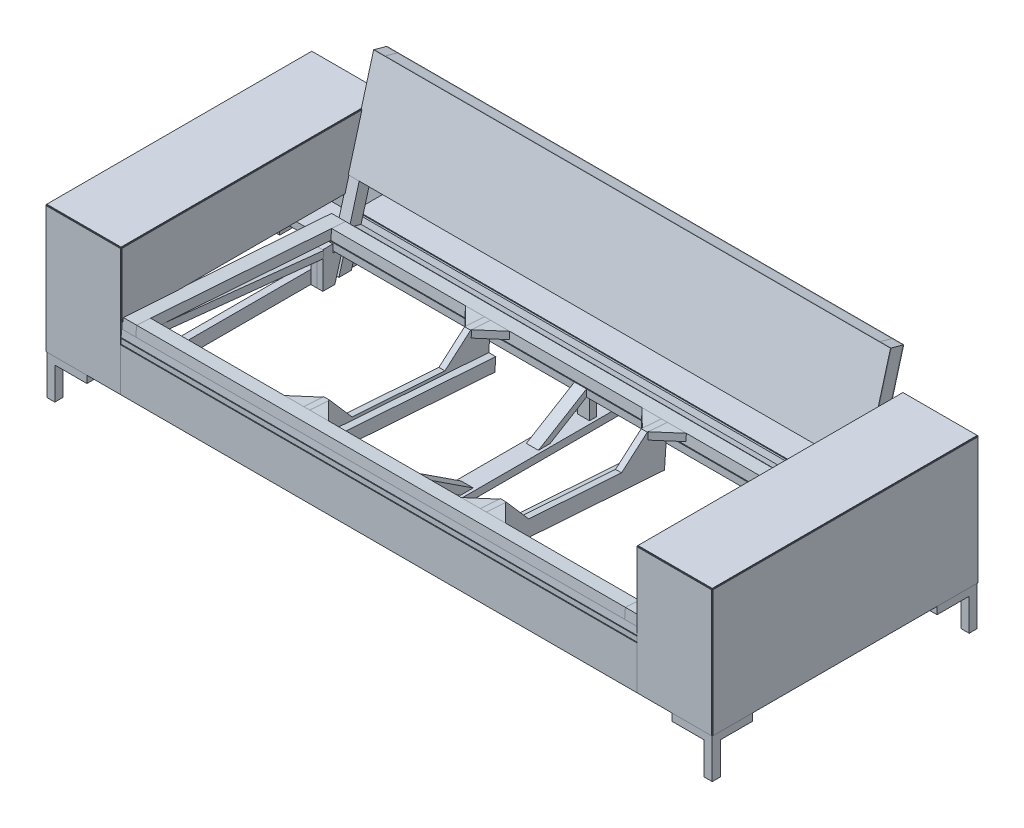
from build123d import *

# Parameters (mm, degrees)
SKETCH1_W              = 22.225
SKETCH1_H              = 41.275
BOSS_EXTRUDE1_DEPTH    = 838.2
SKETCH1_W_2            = 41.275
SKETCH1_H_2            = 22.225
BOSS_EXTRUDE1_2_DEPTH  = 838.2
BOSS_EXTRUDE1_3_DEPTH  = 838.2
BOSS_EXTRUDE1_4_DEPTH  = 838.2
BOSS_EXTRUDE1_5_DEPTH  = 838.2
BOSS_EXTRUDE1_6_DEPTH  = 838.2
BOSS_EXTRUDE1_7_DEPTH  = 838.2
SKETCH1_3_W            = 234.95
SKETCH1_3_H            = 2.54
EXTRUDE_THIN1_DEPTH    = 838.2
SKETCH1_4_W            = 2.54
SKETCH1_4_H            = 400.05
EXTRUDE_THIN2_DEPTH    = 838.2
SKETCH1_5_W            = 2.54
SKETCH1_5_H            = 203.2
EXTRUDE_THIN3_DEPTH    = 838.2
BOSS_EXTRUDE2_DEPTH    = 22.225
SKETCH3_W              = 74.6125
SKETCH3_H              = 41.275
BOSS_EXTRUDE3_DEPTH    = 22.225
BOSS_EXTRUDE3_2_DEPTH  = 22.225
BOSS_EXTRUDE3_3_DEPTH  = 22.225
BOSS_EXTRUDE3_4_DEPTH  = 22.225
SKETCH4_W              = 190.5
SKETCH4_H              = 111.125
BOSS_EXTRUDE4_DEPTH    = 22.225
BOSS_EXTRUDE4_2_DEPTH  = 22.225
EXTRUDE_THIN4_START    = -400.05
SKETCH4_3_W            = 234.95
SKETCH4_3_H            = 2.54
EXTRUDE_THIN4_DEPTH    = 400.05
SKETCH4_4_W            = 234.95
SKETCH4_4_H            = 2.54
EXTRUDE_THIN5_DEPTH    = 400.05
BOSS_EXTRUDE6_DEPTH    = 19.05
BOSS_EXTRUDE7_START    = 19.05
BOSS_EXTRUDE7_DEPTH    = 19.05
BOSS_EXTRUDE20_DEPTH   = 34.925
BOSS_EXTRUDE9_START    = 19.05
SKETCH5_4_W            = 41.275
SKETCH5_4_H            = 22.225
BOSS_EXTRUDE9_DEPTH    = 1597.025
SKETCH5_4_W_2          = 22.225
SKETCH5_4_H_2          = 41.275
BOSS_EXTRUDE9_2_DEPTH  = 1597.025
BOSS_EXTRUDE9_3_DEPTH  = 1597.025
BOSS_EXTRUDE9_4_DEPTH  = 1597.025
BOSS_EXTRUDE10_START   = 34.925
BOSS_EXTRUDE10_DEPTH   = 1562.1
BOSS_EXTRUDE11_DEPTH   = 1635.125
BOSS_EXTRUDE11_2_DEPTH = 1635.125
BOSS_EXTRUDE11_3_DEPTH = 1635.125
SKETCH5_8_W            = 22.225
SKETCH5_8_H            = 28.575
BOSS_EXTRUDE13_DEPTH   = 41.275
SKETCH5_9_W            = 2.54
SKETCH5_9_H            = 136.525
EXTRUDE_THIN6_DEPTH    = 1635.125
BOSS_EXTRUDE14_DEPTH   = 41.275
BOSS_EXTRUDE15_DEPTH   = 44.45
SKETCH7_W              = 1546.225
SKETCH7_H              = 44.45
BOSS_EXTRUDE16_DEPTH   = 31.828939175
BOSS_EXTRUDE16_2_DEPTH = 31.828939175
EXTRUDE_THIN9_DEPTH    = 1635.125
BOSS_EXTRUDE21_START   = -34.925
BOSS_EXTRUDE21_DEPTH   = 1565.275
BOSS_EXTRUDE21_2_DEPTH = 1565.275
EXTRUDE_THIN11_DEPTH   = 1635.125
EXTRUDE_THIN11_2_DEPTH = 1635.125
BOSS_EXTRUDE25_DEPTH   = 19.05
BOSS_EXTRUDE26_DEPTH   = 22.225
BOSS_EXTRUDE27_DEPTH   = 22.225
BOSS_EXTRUDE27_2_DEPTH = 22.225
BOSS_EXTRUDE27_3_DEPTH = 22.225
BOSS_EXTRUDE27_4_DEPTH = 22.225
SKETCH16_W             = 774.7
SKETCH16_H             = 22.225
BOSS_EXTRUDE28_DEPTH   = 28.575
BOSS_EXTRUDE29_DEPTH   = 19.05
BOSS_EXTRUDE29_2_DEPTH = 19.05
SKETCH16_3_W           = 22.225
SKETCH16_3_H           = 69.728910875
BOSS_EXTRUDE29_3_DEPTH = 19.05
SKETCH13_W             = 22.225
SKETCH13_H             = 101.6
SKETCH13_H_2           = 25.4
SKETCH13_W_2           = 3.175
BOSS_EXTRUDE22_DEPTH   = 25.4
BOSS_EXTRUDE23_START   = 0.508
SKETCH13_3_R           = 2.4892
BOSS_EXTRUDE23_DEPTH   = 2.032
SKETCH13_4_W           = 22.225
SKETCH13_4_H           = 25.4
SKETCH13_4_W_2         = 3.175
BOSS_EXTRUDE24_DEPTH   = 127
CHAMFER1_SIZE          = 1.27


with BuildPart() as part:
    # Sketch1 → Boss-Extrude1 (new body)
    with BuildSketch(Plane.XY):
        with Locations((-1041.4, 379.4125)):
            Rectangle(SKETCH1_W, SKETCH1_H)
    extrude(amount=BOSS_EXTRUDE1_DEPTH)


with BuildPart() as body_2:
    # Sketch1 → Boss-Extrude1 2 (new body)
    with BuildSketch(Plane.XY):
        with Locations((-935.0375, 388.9375)):
            Rectangle(SKETCH1_W_2, SKETCH1_H_2)
    extrude(amount=BOSS_EXTRUDE1_2_DEPTH)


with BuildPart() as body_3:
    # Sketch1 → Boss-Extrude1 3 (new body)
    with BuildSketch(Plane.XY):
        with Locations((-828.675, 379.4125)):
            Rectangle(SKETCH1_W, SKETCH1_H)
    extrude(amount=BOSS_EXTRUDE1_3_DEPTH)


with BuildPart() as body_4:
    # Sketch1 → Boss-Extrude1 4 (new body)
    with BuildSketch(Plane.XY):
        with Locations((-828.675, 207.9625)):
            Rectangle(SKETCH1_W, SKETCH1_H_2)
    extrude(amount=BOSS_EXTRUDE1_4_DEPTH)


with BuildPart() as body_5:
    # Sketch1 → Boss-Extrude1 5 (new body)
    with BuildSketch(Plane.XY):
        with Locations((-828.675, 20.6375)):
            Rectangle(SKETCH1_W, SKETCH1_H)
    extrude(amount=BOSS_EXTRUDE1_5_DEPTH)


with BuildPart() as body_6:
    # Sketch1 → Boss-Extrude1 6 (new body)
    with BuildSketch(Plane.XY):
        with Locations((-1041.4, 20.6375)):
            Rectangle(SKETCH1_W, SKETCH1_H)
    extrude(amount=BOSS_EXTRUDE1_6_DEPTH)


with BuildPart() as body_7:
    # Sketch1 → Boss-Extrude1 7 (new body)
    with BuildSketch(Plane.XY):
        with Locations((-1041.4, 207.9625)):
            Rectangle(SKETCH1_W, SKETCH1_H_2)
    extrude(amount=BOSS_EXTRUDE1_7_DEPTH)


with BuildPart() as body_8:
    # Sketch1<3> → Extrude-Thin1 (new body)
    with BuildSketch(Plane.XY):
        with Locations((-935.0375, 401.32)):
            Rectangle(SKETCH1_3_W, SKETCH1_3_H)
    extrude(amount=EXTRUDE_THIN1_DEPTH)


with BuildPart() as body_9:
    # Sketch1<4> → Extrude-Thin2 (new body)
    with BuildSketch(Plane.XY):
        with Locations((-1053.7825, 200.025)):
            Rectangle(SKETCH1_4_W, SKETCH1_4_H)
    extrude(amount=EXTRUDE_THIN2_DEPTH)


with BuildPart() as body_10:
    # Sketch1<5> → Extrude-Thin3 (new body)
    with BuildSketch(Plane.XY):
        with Locations((-816.2925, 298.45)):
            Rectangle(SKETCH1_5_W, SKETCH1_5_H)
    extrude(amount=EXTRUDE_THIN3_DEPTH)


with BuildPart() as body_11:
    # Sketch2 → Boss-Extrude2 (new body)
    with BuildSketch(Plane.ZY.offset(817.5625)):
        Polygon((0, 219.075), (139.7, 219.075), (95.25, 358.775), (0, 358.775), align=None)
    extrude(amount=BOSS_EXTRUDE2_DEPTH)


with BuildPart() as body_12:
    # Sketch3 → Boss-Extrude3 (new body)
    with BuildSketch(Plane.XZ.offset(-400.05)):
        with Locations((-877.09375, 261.9375)):
            Rectangle(SKETCH3_W, SKETCH3_H)
    extrude(amount=BOSS_EXTRUDE3_DEPTH)


with BuildPart() as body_13:
    # Sketch3 → Boss-Extrude3 2 (new body)
    with BuildSketch(Plane.XZ.offset(-400.05)):
        with Locations((-992.98125, 261.9375)):
            Rectangle(SKETCH3_W, SKETCH3_H)
    extrude(amount=BOSS_EXTRUDE3_2_DEPTH)


with BuildPart() as body_14:
    # Sketch3 → Boss-Extrude3 3 (new body)
    with BuildSketch(Plane.XZ.offset(-400.05)):
        with Locations((-877.09375, 604.8375)):
            Rectangle(SKETCH3_W, SKETCH3_H)
    extrude(amount=BOSS_EXTRUDE3_3_DEPTH)


with BuildPart() as body_15:
    # Sketch3 → Boss-Extrude3 4 (new body)
    with BuildSketch(Plane.XZ.offset(-400.05)):
        with Locations((-992.98125, 604.8375)):
            Rectangle(SKETCH3_W, SKETCH3_H)
    extrude(amount=BOSS_EXTRUDE3_4_DEPTH)


with BuildPart() as body_16:
    # Sketch4 → Boss-Extrude4 (new body)
    with BuildSketch(Plane.XZ):
        with Locations((-935.0375, 55.5625)):
            Rectangle(SKETCH4_W, SKETCH4_H)
    extrude(amount=-BOSS_EXTRUDE4_DEPTH)


with BuildPart() as body_17:
    # Sketch4 → Boss-Extrude4 2 (new body)
    with BuildSketch(Plane.XZ):
        with Locations((-935.0375, 782.6375)):
            Rectangle(SKETCH4_W, SKETCH4_H)
    extrude(amount=-BOSS_EXTRUDE4_2_DEPTH)


with BuildPart() as body_18:
    # Sketch4<3> → Extrude-Thin4 (new body)
    with BuildSketch(Plane.XZ.offset(EXTRUDE_THIN4_START)):
        with Locations((-935.0375, 839.47)):
            Rectangle(SKETCH4_3_W, SKETCH4_3_H)
    extrude(amount=EXTRUDE_THIN4_DEPTH)


with BuildPart() as body_19:
    # Sketch4<4> → Extrude-Thin5 (new body)
    with BuildSketch(Plane.XZ):
        with Locations((-935.0375, -1.27)):
            Rectangle(SKETCH4_4_W, SKETCH4_4_H)
    extrude(amount=-EXTRUDE_THIN5_DEPTH)


with BuildPart() as body_20:
    # Mirror Arm Geo: mirrored copy
    add(body_15.part.mirror(Plane(origin=(0, 0, 0), x_dir=(0, 0, 1), z_dir=(1, 0, 0))))


with BuildPart() as body_21:
    # Mirror Arm Geo 2: mirrored copy
    add(body_17.part.mirror(Plane(origin=(0, 0, 0), x_dir=(0, 0, 1), z_dir=(1, 0, 0))))


with BuildPart() as body_22:
    # Mirror Arm Geo 3: mirrored copy
    add(body_3.part.mirror(Plane(origin=(0, 0, 0), x_dir=(0, 0, 1), z_dir=(1, 0, 0))))


with BuildPart() as body_23:
    # Mirror Arm Geo 4: mirrored copy
    add(body_7.part.mirror(Plane(origin=(0, 0, 0), x_dir=(0, 0, 1), z_dir=(1, 0, 0))))


with BuildPart() as body_24:
    # Mirror Arm Geo 5: mirrored copy
    add(body_14.part.mirror(Plane(origin=(0, 0, 0), x_dir=(0, 0, 1), z_dir=(1, 0, 0))))


with BuildPart() as body_25:
    # Mirror Arm Geo 6: mirrored copy
    add(body_4.part.mirror(Plane(origin=(0, 0, 0), x_dir=(0, 0, 1), z_dir=(1, 0, 0))))


with BuildPart() as body_26:
    # Mirror Arm Geo 7: mirrored copy
    add(body_19.part.mirror(Plane(origin=(0, 0, 0), x_dir=(0, 0, 1), z_dir=(1, 0, 0))))


with BuildPart() as body_27:
    # Mirror Arm Geo 8: mirrored copy
    add(body_8.part.mirror(Plane(origin=(0, 0, 0), x_dir=(0, 0, 1), z_dir=(1, 0, 0))))


with BuildPart() as body_28:
    # Mirror Arm Geo 9: mirrored copy
    add(body_18.part.mirror(Plane(origin=(0, 0, 0), x_dir=(0, 0, 1), z_dir=(1, 0, 0))))


with BuildPart() as body_29:
    # Mirror Arm Geo 10: mirrored copy
    add(body_9.part.mirror(Plane(origin=(0, 0, 0), x_dir=(0, 0, 1), z_dir=(1, 0, 0))))


with BuildPart() as body_30:
    # Mirror Arm Geo 11: mirrored copy
    add(body_13.part.mirror(Plane(origin=(0, 0, 0), x_dir=(0, 0, 1), z_dir=(1, 0, 0))))


with BuildPart() as body_31:
    # Mirror Arm Geo 12: mirrored copy
    add(body_11.part.mirror(Plane(origin=(0, 0, 0), x_dir=(0, 0, 1), z_dir=(1, 0, 0))))


with BuildPart() as body_32:
    # Mirror Arm Geo 13: mirrored copy
    add(body_5.part.mirror(Plane(origin=(0, 0, 0), x_dir=(0, 0, 1), z_dir=(1, 0, 0))))


with BuildPart() as body_33:
    # Mirror Arm Geo 14: mirrored copy
    add(part.part.mirror(Plane(origin=(0, 0, 0), x_dir=(0, 0, 1), z_dir=(1, 0, 0))))


with BuildPart() as body_34:
    # Mirror Arm Geo 15: mirrored copy
    add(body_16.part.mirror(Plane(origin=(0, 0, 0), x_dir=(0, 0, 1), z_dir=(1, 0, 0))))


with BuildPart() as body_35:
    # Mirror Arm Geo 16: mirrored copy
    add(body_2.part.mirror(Plane(origin=(0, 0, 0), x_dir=(0, 0, 1), z_dir=(1, 0, 0))))


with BuildPart() as body_36:
    # Mirror Arm Geo 17: mirrored copy
    add(body_6.part.mirror(Plane(origin=(0, 0, 0), x_dir=(0, 0, 1), z_dir=(1, 0, 0))))


with BuildPart() as body_37:
    # Mirror Arm Geo 18: mirrored copy
    add(body_10.part.mirror(Plane(origin=(0, 0, 0), x_dir=(0, 0, 1), z_dir=(1, 0, 0))))


with BuildPart() as body_38:
    # Mirror Arm Geo 19: mirrored copy
    add(body_12.part.mirror(Plane(origin=(0, 0, 0), x_dir=(0, 0, 1), z_dir=(1, 0, 0))))


with BuildPart() as body_39:
    # Sketch5 → Boss-Extrude6 (new body)
    with BuildSketch(Plane(origin=(-817.5625, 0, 0), x_dir=(0, 0, -1), z_dir=(1, 0, 0))):
        Polygon((-111.125, 130.175), (-113.922886362, 120.038076396), (-150.649617496, 130.175), (-238.125, 130.175), (-238.125, 0), (0, 0), (0, 130.175), align=None)
    extrude(amount=BOSS_EXTRUDE6_DEPTH)


with BuildPart() as body_40:
    # Sketch5<3> → Boss-Extrude7 (new body)
    with BuildSketch(Plane(origin=(-817.5625, 0, 0), x_dir=(0, 0, -1), z_dir=(1, 0, 0)).offset(BOSS_EXTRUDE7_START)):
        Polygon((-200.025, 0), (-188.232142857, 41.275), (-238.125, 41.275), (-238.125, 0), align=None)
        Polygon((-206.375, 114.178910875), (-238.125, 114.178910875), (-238.125, 41.275), (-188.232142857, 41.275), (-174.625, 88.9), (-206.375, 88.9), align=None)
    extrude(amount=BOSS_EXTRUDE7_DEPTH)


with BuildPart() as body_41:
    # Sketch5<12> → Boss-Extrude20 (new body)
    with BuildSketch(Plane(origin=(-817.5625, 0, 0), x_dir=(0, 0, -1), z_dir=(1, 0, 0))):
        Polygon((-150.649617496, 130.175), (-111.125, 130.175), (0, 532.788076396), (-36.726731135, 542.925), align=None)
        Polygon((-124.904553599, 80.250784333), (-113.922886362, 120.038076396), (-135.346812857, 125.951281832), (-146.328480095, 86.163989769), align=None)
        Polygon((-135.346812857, 125.951281832), (-150.649617496, 130.175), (-161.198997976, 91.953910875), (-175.186854559, 41.275), (-135.662237063, 41.275), (-124.904553599, 80.250784333), (-146.328480095, 86.163989769), align=None)
        Polygon((-135.662237063, 41.275), (-175.186854559, 41.275), (-183.95015351, 9.525), (-144.425536013, 9.525), align=None)
        Polygon((-113.922886362, 120.038076396), (-111.125, 130.175), (-150.649617496, 130.175), (-135.346812857, 125.951281832), align=None)
    extrude(amount=BOSS_EXTRUDE20_DEPTH)


with BuildPart() as body_42:
    # Sketch5<4> → Boss-Extrude9 (new body)
    with BuildSketch(Plane(origin=(-817.5625, 0, 0), x_dir=(0, 0, -1), z_dir=(1, 0, 0)).offset(BOSS_EXTRUDE9_START)):
        with Locations((-20.6375, 11.1125)):
            Rectangle(SKETCH5_4_W, SKETCH5_4_H)
    extrude(amount=BOSS_EXTRUDE9_DEPTH)


with BuildPart() as body_43:
    # Sketch5<4> → Boss-Extrude9 2 (new body)
    with BuildSketch(Plane(origin=(-817.5625, 0, 0), x_dir=(0, 0, -1), z_dir=(1, 0, 0)).offset(BOSS_EXTRUDE9_START)):
        with Locations((-11.1125, 109.5375)):
            Rectangle(SKETCH5_4_W_2, SKETCH5_4_H_2)
    extrude(amount=BOSS_EXTRUDE9_2_DEPTH)


with BuildPart() as body_44:
    # Sketch5<4> → Boss-Extrude9 3 (new body)
    with BuildSketch(Plane(origin=(-817.5625, 0, 0), x_dir=(0, 0, -1), z_dir=(1, 0, 0)).offset(BOSS_EXTRUDE9_START)):
        Polygon((-79.375, 124.261794564), (-100.798926495, 130.175), (-111.780593733, 90.387707937), (-90.356667238, 84.474502502), align=None)
    extrude(amount=BOSS_EXTRUDE9_3_DEPTH)


with BuildPart() as body_45:
    # Sketch5<4> → Boss-Extrude9 4 (new body)
    with BuildSketch(Plane(origin=(-817.5625, 0, 0), x_dir=(0, 0, -1), z_dir=(1, 0, 0)).offset(BOSS_EXTRUDE9_START)):
        with Locations((-181.836497976, 103.066410875)):
            Rectangle(SKETCH5_4_W, SKETCH5_4_H)
    extrude(amount=BOSS_EXTRUDE9_4_DEPTH)


with BuildPart() as body_46:
    # Sketch5<5> → Boss-Extrude10 (new body)
    with BuildSketch(Plane(origin=(-817.5625, 0, 0), x_dir=(0, 0, -1), z_dir=(1, 0, 0)).offset(BOSS_EXTRUDE10_START)):
        Polygon((-124.904553599, 80.250784333), (-113.922886362, 120.038076396), (-135.346812857, 125.951281832), (-146.328480095, 86.163989769), align=None)
    extrude(amount=BOSS_EXTRUDE10_DEPTH)


with BuildPart() as body_47:
    # Sketch5<7> → Boss-Extrude11 (new body)
    with BuildSketch(Plane(origin=(-817.5625, 0, 0), x_dir=(0, 0, -1), z_dir=(1, 0, 0))):
        Polygon((-838.2, 0), (-815.975, 0), (-815.975, 12.7), (-815.975, 41.275), (-838.2, 41.275), align=None)
    extrude(amount=BOSS_EXTRUDE11_DEPTH)


with BuildPart() as body_48:
    # Sketch5<7> → Boss-Extrude11 2 (new body)
    with BuildSketch(Plane(origin=(-817.5625, 0, 0), x_dir=(0, 0, -1), z_dir=(1, 0, 0))):
        Polygon((-815.975, 150.070467631), (-815.975, 152.4), (-838.2, 152.4), (-838.2, 136.525), (-838.2, 111.125), (-815.975, 111.125), align=None)
    extrude(amount=BOSS_EXTRUDE11_2_DEPTH)


with BuildPart() as body_49:
    # Sketch5<7> → Boss-Extrude11 3 (new body)
    with BuildSketch(Plane(origin=(-817.5625, 0, 0), x_dir=(0, 0, -1), z_dir=(1, 0, 0))):
        Polygon((-794.833039494, 172.530739813), (-835.883159691, 176.833443244), (-838.2, 154.729532369), (-815.975, 152.4), (-797.149879803, 150.426828938), align=None)
    extrude(amount=BOSS_EXTRUDE11_3_DEPTH)


with BuildPart() as body_50:
    # Sketch5<8> → Boss-Extrude13 (new body)
    with BuildSketch(Plane(origin=(-817.5625, 0, 0), x_dir=(0, 0, -1), z_dir=(1, 0, 0))):
        Polygon((-815.975, 41.275), (-793.75, 41.275), (-793.75, 150.070467631), (-815.975, 150.070467631), (-815.975, 111.125), align=None)
        with Locations((-804.8625, 26.9875)):
            Rectangle(SKETCH5_8_W, SKETCH5_8_H)
    extrude(amount=BOSS_EXTRUDE13_DEPTH)


with BuildPart() as body_51:
    # Sketch5<9> → Extrude-Thin6 (new body)
    with BuildSketch(Plane(origin=(-817.5625, 0, 0), x_dir=(0, 0, -1), z_dir=(1, 0, 0))):
        with Locations((-839.47, 68.2625)):
            Rectangle(SKETCH5_9_W, SKETCH5_9_H)
    extrude(amount=EXTRUDE_THIN6_DEPTH)


with BuildPart() as body_52:
    # Sketch5<10> → Boss-Extrude14 (new body)
    with BuildSketch(Plane(origin=(-817.5625, 0, 0), x_dir=(0, 0, -1), z_dir=(1, 0, 0))):
        Polygon((-240.441840309, 92.075), (-238.125, 114.178910875), (-794.833039494, 172.530739813), (-797.149879803, 150.426828938), (-793.75, 150.070467631), align=None)
    extrude(amount=BOSS_EXTRUDE14_DEPTH)


with BuildPart() as body_53:
    # Sketch5<11> → Boss-Extrude15 (new body)
    with BuildSketch(Plane(origin=(-817.5625, 0, 0), x_dir=(0, 0, -1), z_dir=(1, 0, 0))):
        Polygon((-835.883159691, 176.833443244), (-174.625, 130.175), (-172.384716759, 161.925), (-833.64287645, 208.583443244), align=None)
    extrude(amount=BOSS_EXTRUDE15_DEPTH)


with BuildPart() as body_54:
    # Mirror2: mirrored copy
    add(body_39.part.mirror(Plane(origin=(0, 0, 0), x_dir=(0, 0, 1), z_dir=(1, 0, 0))))


with BuildPart() as body_55:
    # Mirror2 2: mirrored copy
    add(body_40.part.mirror(Plane(origin=(0, 0, 0), x_dir=(0, 0, 1), z_dir=(1, 0, 0))))


with BuildPart() as body_56:
    # Mirror2 3: mirrored copy
    add(body_50.part.mirror(Plane(origin=(0, 0, 0), x_dir=(0, 0, 1), z_dir=(1, 0, 0))))


with BuildPart() as body_57:
    # Mirror2 4: mirrored copy
    add(body_52.part.mirror(Plane(origin=(0, 0, 0), x_dir=(0, 0, 1), z_dir=(1, 0, 0))))


with BuildPart() as body_58:
    # Mirror2 5: mirrored copy
    add(body_53.part.mirror(Plane(origin=(0, 0, 0), x_dir=(0, 0, 1), z_dir=(1, 0, 0))))


with BuildPart() as body_59:
    # Mirror2 6: mirrored copy
    add(body_41.part.mirror(Plane(origin=(0, 0, 0), x_dir=(0, 0, 1), z_dir=(1, 0, 0))))


with BuildPart() as body_60:
    # Sketch7 → Boss-Extrude16 (new body)
    with BuildSketch(Plane(origin=(0, 149.01958879, -10.514837396), x_dir=(1, 0, 0), z_dir=(0, 0.9975198929986313, -0.07038510546983275))):
        with Locations((0, -824.031520568)):
            Rectangle(SKETCH7_W, SKETCH7_H)
    extrude(amount=-BOSS_EXTRUDE16_DEPTH)


with BuildPart() as body_61:
    # Sketch7 → Boss-Extrude16 2 (new body)
    with BuildSketch(Plane(origin=(0, 149.01958879, -10.514837396), x_dir=(1, 0, 0), z_dir=(0, 0.9975198929986313, -0.07038510546983275))):
        with Locations((0, -205.579292419)):
            Rectangle(SKETCH7_W, SKETCH7_H)
    extrude(amount=-BOSS_EXTRUDE16_2_DEPTH)


with BuildPart() as body_62:
    # Sketch8 → Extrude-Thin9 (new body)
    with BuildSketch(Plane.ZY.offset(817.5625)):
        Polygon((0, 0), (0, 130.175), (95.25, 130.175), (95.25, 132.715), (-2.54, 132.715), (-2.54, 0), align=None)
    extrude(amount=-EXTRUDE_THIN9_DEPTH)


with BuildPart() as body_63:
    # Sketch12 → Boss-Extrude21 (new body)
    with BuildSketch(Plane.ZY.offset(817.5625).offset(BOSS_EXTRUDE21_START)):
        Polygon((119.511607233, 242.990029066), (113.598401798, 264.413955561), (76.871670663, 254.277031957), (82.784876098, 232.853105462), align=None)
    extrude(amount=-BOSS_EXTRUDE21_DEPTH)


with BuildPart() as body_64:
    # Sketch12 → Boss-Extrude21 2 (new body)
    with BuildSketch(Plane.ZY.offset(817.5625).offset(BOSS_EXTRUDE21_START)):
        Polygon((42.63993657, 521.501073505), (36.726731135, 542.925), (0, 532.788076396), (5.913205436, 511.364149901), align=None)
    extrude(amount=-BOSS_EXTRUDE21_2_DEPTH)


with BuildPart() as body_65:
    # Sketch12<3> → Extrude-Thin11 (new body)
    with BuildSketch(Plane.ZY.offset(817.5625)):
        Polygon((119.511607233, 242.990029066), (36.726731135, 542.925), (39.175179877, 543.600794907), (121.960055976, 243.665823973), align=None)
    extrude(amount=-EXTRUDE_THIN11_DEPTH)


with BuildPart() as body_66:
    # Sketch12<3> → Extrude-Thin11 2 (new body)
    with BuildSketch(Plane.ZY.offset(817.5625)):
        Polygon((0, 532.788076396), (82.784876098, 232.853105462), (80.336427356, 232.177310555), (-2.448448742, 532.112281489), align=None)
    extrude(amount=-EXTRUDE_THIN11_2_DEPTH)


with BuildPart() as body_67:
    # Sketch14 → Boss-Extrude25 (new body)
    with BuildSketch(Plane(origin=(-269.875, 0, 0), x_dir=(0, 0, -1), z_dir=(1, 0, 0))):
        Polygon((-725.960604001, 200.985371109), (-789.303117206, 205.454825306), (-795.336880373, 119.942432479), (-509.047559771, 99.741828795), (-508.377141641, 109.243205776), (-655.312933191, 119.611010226), align=None)
        Polygon((-509.047559771, 99.741828795), (-795.336880373, 119.942432479), (-798.242025601, 78.769798895), (-511.952704999, 58.569195211), align=None)
        Polygon((-222.758239169, 79.541225111), (-509.047559771, 99.741828795), (-511.952704999, 58.569195211), (-225.663384398, 38.368591527), align=None)
        Polygon((-508.377141641, 109.243205776), (-509.047559771, 99.741828795), (-222.758239169, 79.541225111), (-216.724476003, 165.053617938), (-280.066989208, 169.523072135), (-361.441350092, 98.875401326), align=None)
    extrude(amount=-BOSS_EXTRUDE25_DEPTH)


with BuildPart() as body_68:
    # Sketch14<3> → Boss-Extrude26 (new body)
    with BuildSketch(Plane(origin=(-269.875, 0, 0), x_dir=(0, 0, -1), z_dir=(1, 0, 0))):
        Polygon((-509.047559771, 99.741828795), (-795.336880373, 119.942432479), (-798.242025601, 78.769798895), (-511.952704999, 58.569195211), align=None)
        Polygon((-222.758239169, 79.541225111), (-509.047559771, 99.741828795), (-511.952704999, 58.569195211), (-225.663384398, 38.368591527), align=None)
    extrude(amount=BOSS_EXTRUDE26_DEPTH)


with BuildPart() as body_69:
    # Sketch15 → Boss-Extrude27 (new body)
    with BuildSketch(Plane(origin=(0, 149.01958879, -10.514837396), x_dir=(1, 0, 0), z_dir=(0, 0.9975198929986313, -0.07038510546983293))):
        Polygon((-288.925, -227.804292419), (-349.25, -227.804292419), (-288.925, -288.129292419), align=None)
    extrude(amount=-BOSS_EXTRUDE27_DEPTH)


with BuildPart() as body_70:
    # Sketch15 → Boss-Extrude27 2 (new body)
    with BuildSketch(Plane(origin=(0, 149.01958879, -10.514837396), x_dir=(1, 0, 0), z_dir=(0, 0.9975198929986313, -0.07038510546983293))):
        Polygon((-269.875, -227.804292419), (-209.55, -227.804292419), (-269.875, -288.129292419), align=None)
    extrude(amount=-BOSS_EXTRUDE27_2_DEPTH)


with BuildPart() as body_71:
    # Sketch15 → Boss-Extrude27 3 (new body)
    with BuildSketch(Plane(origin=(0, 149.01958879, -10.514837396), x_dir=(1, 0, 0), z_dir=(0, 0.9975198929986313, -0.07038510546983293))):
        Polygon((-269.875, -801.806520568), (-269.875, -741.481520568), (-209.55, -801.806520568), align=None)
    extrude(amount=-BOSS_EXTRUDE27_3_DEPTH)


with BuildPart() as body_72:
    # Sketch15 → Boss-Extrude27 4 (new body)
    with BuildSketch(Plane(origin=(0, 149.01958879, -10.514837396), x_dir=(1, 0, 0), z_dir=(0, 0.9975198929986313, -0.07038510546983293))):
        Polygon((-288.925, -801.806520568), (-349.25, -801.806520568), (-288.925, -741.481520568), align=None)
    extrude(amount=-BOSS_EXTRUDE27_4_DEPTH)


with BuildPart() as body_73:
    # Mirror6: mirrored copy
    add(body_68.part.mirror(Plane(origin=(0, 0, 0), x_dir=(0, 0, 1), z_dir=(1, 0, 0))))


with BuildPart() as body_74:
    # Mirror6 2: mirrored copy
    add(body_67.part.mirror(Plane(origin=(0, 0, 0), x_dir=(0, 0, 1), z_dir=(1, 0, 0))))


with BuildPart() as body_75:
    # Mirror6 3: mirrored copy
    add(body_70.part.mirror(Plane(origin=(0, 0, 0), x_dir=(0, 0, 1), z_dir=(1, 0, 0))))


with BuildPart() as body_76:
    # Mirror6 4: mirrored copy
    add(body_69.part.mirror(Plane(origin=(0, 0, 0), x_dir=(0, 0, 1), z_dir=(1, 0, 0))))


with BuildPart() as body_77:
    # Mirror6 5: mirrored copy
    add(body_71.part.mirror(Plane(origin=(0, 0, 0), x_dir=(0, 0, 1), z_dir=(1, 0, 0))))


with BuildPart() as body_78:
    # Mirror6 6: mirrored copy
    add(body_72.part.mirror(Plane(origin=(0, 0, 0), x_dir=(0, 0, 1), z_dir=(1, 0, 0))))


with BuildPart() as body_79:
    # Sketch16 → Boss-Extrude28 (new, symmetric)
    with BuildSketch(Plane(origin=(0, 0, 0), x_dir=(0, 0, -1), z_dir=(1, 0, 0))):
        with Locations((-428.625, 11.1125)):
            Rectangle(SKETCH16_W, SKETCH16_H)
    extrude(amount=BOSS_EXTRUDE28_DEPTH, both=True)


with BuildPart() as body_80:
    # Sketch16<3> → Boss-Extrude29 (new, symmetric)
    with BuildSketch(Plane(origin=(0, 0, 0), x_dir=(0, 0, -1), z_dir=(1, 0, 0))):
        Polygon((-797.149879803, 150.426828938), (-601.369357174, 22.225), (-560.799642116, 22.225), (-794.544182941, 175.286587718), align=None)
    extrude(amount=BOSS_EXTRUDE29_DEPTH, both=True)


with BuildPart() as body_81:
    # Sketch16<3> → Boss-Extrude29 2 (new, symmetric)
    with BuildSketch(Plane(origin=(0, 0, 0), x_dir=(0, 0, -1), z_dir=(1, 0, 0))):
        Polygon((-202.473997976, 114.178910875), (-354.649285966, 22.225), (-317.868949563, 22.225), (-202.473997976, 91.953910875), align=None)
    extrude(amount=BOSS_EXTRUDE29_2_DEPTH, both=True)


with BuildPart() as body_82:
    # Sketch16<3> → Boss-Extrude29 3 (new, symmetric)
    with BuildSketch(Plane(origin=(0, 0, 0), x_dir=(0, 0, -1), z_dir=(1, 0, 0))):
        with Locations((-181.836497976, 57.089455438)):
            Rectangle(SKETCH16_3_W, SKETCH16_3_H)
    extrude(amount=BOSS_EXTRUDE29_3_DEPTH, both=True)


with BuildPart() as body_83:
    # Sketch13 → Boss-Extrude22 (new body)
    with BuildSketch(Plane.XZ):
        with Locations((-1041.4, 762)):
            Rectangle(SKETCH13_W, SKETCH13_H)
        with Locations((-1041.4, 825.5)):
            Rectangle(SKETCH13_W, SKETCH13_H_2)
        Polygon((-925.5125, 838.2), (-1027.1125, 838.2), (-1027.1125, 812.8), (-933.45, 812.8), (-925.5125, 812.8), align=None)
        Polygon((-1027.1125, 812.8), (-1030.2875, 812.8), (-1030.2875, 711.2), (-1027.1125, 711.2), (-1027.1125, 719.1375), align=None)
        with Locations((-1028.7, 825.5)):
            Rectangle(SKETCH13_W_2, SKETCH13_H_2)
    extrude(amount=BOSS_EXTRUDE22_DEPTH)

    # Sketch13<3> → Boss-Extrude23 (add)
    with BuildSketch(Plane.XZ.offset(BOSS_EXTRUDE23_START)):
        Polygon((-933.45, 812.8), (-1027.1125, 812.8), (-1027.1125, 719.1375), align=None)
        with Locations((-1016.1905, 741.553)):
            Circle(SKETCH13_3_R, mode=Mode.SUBTRACT)
        with Locations((-1016.1905, 801.878)):
            Circle(SKETCH13_3_R, mode=Mode.SUBTRACT)
        with Locations((-955.8655, 801.878)):
            Circle(SKETCH13_3_R, mode=Mode.SUBTRACT)
    extrude(amount=BOSS_EXTRUDE23_DEPTH)

    # Sketch13<4> → Boss-Extrude24 (add)
    with BuildSketch(Plane.XZ):
        with Locations((-1041.4, 825.5)):
            Rectangle(SKETCH13_4_W, SKETCH13_4_H)
        with Locations((-1028.7, 825.5)):
            Rectangle(SKETCH13_4_W_2, SKETCH13_4_H)
    extrude(amount=BOSS_EXTRUDE24_DEPTH)

    # Chamfer1
    chamfer1_edges = [body_83.edges().sort_by_distance(p)[0] for p in [
        (-1018.6797, -2.54, 801.878),
        (-958.3547, -2.54, 801.878),
        (-1018.6797, -2.54, 741.553),
    ]]
    chamfer(chamfer1_edges, length=CHAMFER1_SIZE)


with BuildPart() as body_84:
    # Mirror4: mirrored copy
    add(body_83.part.mirror(Plane(origin=(0, 0, 0), x_dir=(0, 0, 1), z_dir=(1, 0, 0))))


with BuildPart() as body_85:
    # Mirror5: mirrored copy
    add(body_83.part.mirror(Plane.XY.offset(419.1)))


with BuildPart() as body_86:
    # Mirror5 2: mirrored copy
    add(body_84.part.mirror(Plane.XY.offset(419.1)))


solid = Compound([part.part, body_2.part, body_3.part, body_4.part, body_5.part, body_6.part, body_7.part, body_8.part, body_9.part, body_10.part, body_11.part, body_12.part, body_13.part, body_14.part, body_15.part, body_16.part, body_17.part, body_18.part, body_19.part, body_20.part, body_21.part, body_22.part, body_23.part, body_24.part, body_25.part, body_26.part, body_27.part, body_28.part, body_29.part, body_30.part, body_31.part, body_32.part, body_33.part, body_34.part, body_35.part, body_36.part, body_37.part, body_38.part, body_39.part, body_40.part, body_41.part, body_42.part, body_43.part, body_44.part, body_45.part, body_46.part, body_47.part, body_48.part, body_49.part, body_50.part, body_51.part, body_52.part, body_53.part, body_54.part, body_55.part, body_56.part, body_57.part, body_58.part, body_59.part, body_60.part, body_61.part, body_62.part, body_63.part, body_64.part, body_65.part, body_66.part, body_67.part, body_68.part, body_69.part, body_70.part, body_71.part, body_72.part, body_73.part, body_74.part, body_75.part, body_76.part, body_77.part, body_78.part, body_79.part, body_80.part, body_81.part, body_82.part, body_83.part, body_84.part, body_85.part, body_86.part])
